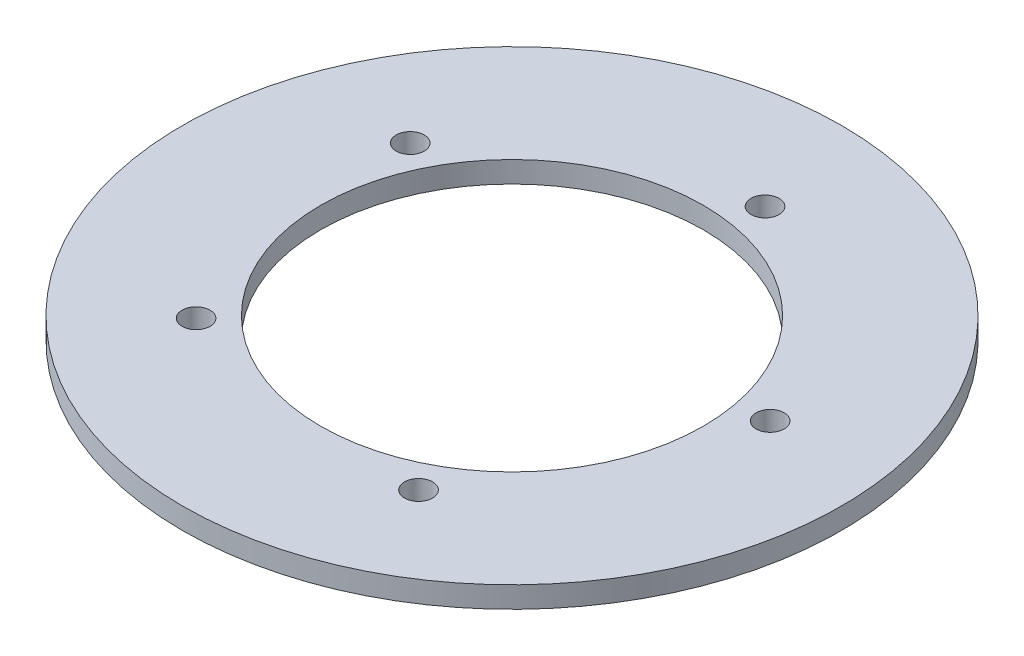
from build123d import *

# Parameters (mm, degrees)
SKETCH1_R            = 77.5
SKETCH1_R_2          = 45
BODY_DEPTH           = 5
M6_CLEARANCE_HOLE1_D = 6.6


with BuildPart() as part:
    # Sketch1 → Body (new body)
    with BuildSketch(Plane(origin=(0, 0, 0), x_dir=(1, 0, 0), z_dir=(0, 1, 0))):
        Circle(SKETCH1_R)
        Circle(SKETCH1_R_2, mode=Mode.SUBTRACT)
    extrude(amount=BODY_DEPTH)

    # M6 Clearance Hole1 (through all)
    with Locations(Plane(origin=(0, 5, 0), x_dir=(1, 0, 0), z_dir=(0, 1, 0))):
        with Locations((7.5, 52), (51.772566305, 8.935959835), (24.497205661, -46.4772731), (-36.632460577, -37.660494315), (-47.13731139, 23.20180758), (0, 0)):
            Hole(M6_CLEARANCE_HOLE1_D / 2)


solid = part.part
